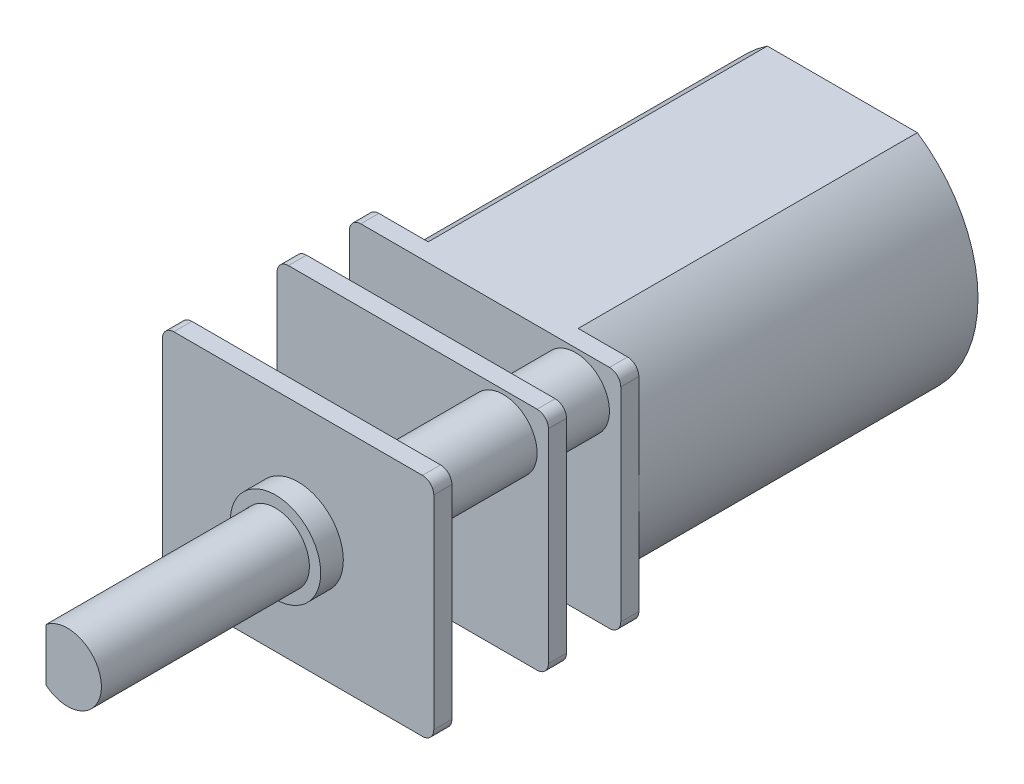
from build123d import *

# Parameters (mm, degrees)
SALIENTE_EXTRUIR1_DEPTH  = 15
SALIENTE_EXTRUIR2_DEPTH  = 0.8
CROQUIS3_R               = 1.5
SALIENTE_EXTRUIR3_DEPTH  = 2.4
SALIENTE_EXTRUIR4_DEPTH  = 0.8
CROQUIS5_R               = 1.5
SALIENTE_EXTRUIR5_DEPTH  = 4.27
SALIENTE_EXTRUIR6_DEPTH  = 0.8
CROQUIS7_R               = 2
SALIENTE_EXTRUIR7_DEPTH  = 1
CROQUIS8_R               = 1.5
SALIENTE_EXTRUIR8_DEPTH  = 9.2
CORTAR_EXTRUIR1_START    = -9
CORTAR_EXTRUIR1_DEPTH    = 9
CROQUIS1_3_R             = 2.5
SALIENTE_EXTRUIR9_DEPTH  = 1
CROQUIS1_4_W             = 0.3
CROQUIS1_4_H             = 1.5
SALIENTE_EXTRUIR10_DEPTH = 1.3
CORTAR_EXTRUIR2_REACH    = 37.993
CROQUIS10_R              = 0.35


with BuildPart() as part:
    # Croquis1 → Saliente-Extruir1 (new body)
    with BuildSketch(Plane.XY):
        with BuildLine():
            Line((3.31662479, 5), (-3.31662479, 5))
            ThreePointArc((-3.31662479, 5), (-6, 0), (-3.31662479, -5))
            Line((-3.31662479, -5), (3.31662479, -5))
            ThreePointArc((3.31662479, -5), (6, 0), (3.31662479, 5))
        make_face()
    extrude(amount=SALIENTE_EXTRUIR1_DEPTH)

    # Croquis2 → Saliente-Extruir2 (add)
    with BuildSketch(Plane.XY.offset(15)):
        with BuildLine():
            Line((-5.5, -5), (5.5, -5))
            ThreePointArc((5.5, -5), (5.853553391, -4.853553391), (6, -4.5))
            Line((6, -4.5), (6, 4.5))
            ThreePointArc((6, 4.5), (5.853553391, 4.853553391), (5.5, 5))
            Line((5.5, 5), (-5.5, 5))
            ThreePointArc((-5.5, 5), (-5.853553391, 4.853553391), (-6, 4.5))
            Line((-6, 4.5), (-6, -4.5))
            ThreePointArc((-6, -4.5), (-5.853553391, -4.853553391), (-5.5, -5))
        make_face()
    extrude(amount=SALIENTE_EXTRUIR2_DEPTH)

    # Croquis3 → Saliente-Extruir3 (add)
    with BuildSketch(Plane.XY.offset(15.8)):
        with Locations((-3.853553391, -3.195226195)):
            Circle(CROQUIS3_R)
        with Locations((4, 3.316654392)):
            Circle(CROQUIS3_R)
    extrude(amount=SALIENTE_EXTRUIR3_DEPTH)

    # Croquis4 → Saliente-Extruir4 (add)
    with BuildSketch(Plane.XY.offset(18.2)):
        with BuildLine():
            Line((5.5, 5), (-5.5, 5))
            ThreePointArc((-5.5, 5), (-5.853553391, 4.853553391), (-6, 4.5))
            Line((-6, 4.5), (-6, -4.5))
            ThreePointArc((-6, -4.5), (-5.853553391, -4.853553391), (-5.5, -5))
            Line((-5.5, -5), (5.5, -5))
            ThreePointArc((5.5, -5), (5.853553391, -4.853553391), (6, -4.5))
            Line((6, -4.5), (6, 4.5))
            ThreePointArc((6, 4.5), (5.853553391, 4.853553391), (5.5, 5))
        make_face()
    extrude(amount=SALIENTE_EXTRUIR4_DEPTH)

    # Croquis5 → Saliente-Extruir5 (add)
    with BuildSketch(Plane.XY.offset(19)):
        with Locations((4, 3.316654392)):
            Circle(CROQUIS5_R)
        with Locations((-3.853553391, -3.195226195)):
            Circle(CROQUIS5_R)
    extrude(amount=SALIENTE_EXTRUIR5_DEPTH)

    # Croquis6 → Saliente-Extruir6 (add)
    with BuildSketch(Plane.XY.offset(23.27)):
        with BuildLine():
            Line((5.5, 5), (-5.5, 5))
            ThreePointArc((-5.5, 5), (-5.853553391, 4.853553391), (-6, 4.5))
            Line((-6, 4.5), (-6, -4.5))
            ThreePointArc((-6, -4.5), (-5.853553391, -4.853553391), (-5.5, -5))
            Line((-5.5, -5), (5.5, -5))
            ThreePointArc((5.5, -5), (5.853553391, -4.853553391), (6, -4.5))
            Line((6, -4.5), (6, 4.5))
            ThreePointArc((6, 4.5), (5.853553391, 4.853553391), (5.5, 5))
        make_face()
    extrude(amount=SALIENTE_EXTRUIR6_DEPTH)

    # Croquis7 → Saliente-Extruir7 (add)
    with BuildSketch(Plane.XY.offset(24.07)):
        Circle(CROQUIS7_R)
    extrude(amount=SALIENTE_EXTRUIR7_DEPTH)

    # Croquis8 → Saliente-Extruir8 (add)
    with BuildSketch(Plane.XY.offset(25.07)):
        Circle(CROQUIS8_R)
    extrude(amount=SALIENTE_EXTRUIR8_DEPTH)

    # Croquis9 → Cortar-Extruir1 (cut)
    with BuildSketch(Plane.XY.offset(34.27).offset(CORTAR_EXTRUIR1_START)):
        with BuildLine():
            Line((-0.95, -1.160818677), (-0.95, 1.160818677))
            ThreePointArc((-0.95, 1.160818677), (-1.5, 0), (-0.95, -1.160818677))
        make_face()
    extrude(amount=CORTAR_EXTRUIR1_DEPTH, mode=Mode.SUBTRACT)

    # Croquis1<3> → Saliente-Extruir9 (add)
    with BuildSketch(Plane.XY):
        Circle(CROQUIS1_3_R)
    extrude(amount=-SALIENTE_EXTRUIR9_DEPTH)

    # Croquis1<4> → Saliente-Extruir10 (add)
    with BuildSketch(Plane.XY):
        with Locations((-3.65, 0)):
            Rectangle(CROQUIS1_4_W, CROQUIS1_4_H)
    saliente_extruir10 = extrude(amount=-SALIENTE_EXTRUIR10_DEPTH)

    # Croquis10 → Cortar-Extruir2 (cut, up to next)
    with BuildSketch(Plane.ZY.offset(3.8), mode=Mode.PRIVATE) as cortar_extruir2_sk1:
        with Locations((-0.65, 0)):
            Circle(CROQUIS10_R)
    cortar_extruir2_tool1 = extrude(cortar_extruir2_sk1.sketch, amount=-CORTAR_EXTRUIR2_REACH, mode=Mode.PRIVATE) & part.part
    cortar_extruir2 = cortar_extruir2_tool1.solids().sort_by_distance((-3.8, 0, -0.65))[0]
    add(cortar_extruir2, mode=Mode.SUBTRACT)

    # Simetría1: Saliente-Extruir10, Cortar-Extruir2 across plane
    add(saliente_extruir10.mirror(Plane(origin=(0, 0, 0), x_dir=(0, 0, 1), z_dir=(1, 0, 0))))
    add(cortar_extruir2.mirror(Plane(origin=(0, 0, 0), x_dir=(0, 0, 1), z_dir=(1, 0, 0))), mode=Mode.SUBTRACT)


solid = part.part
